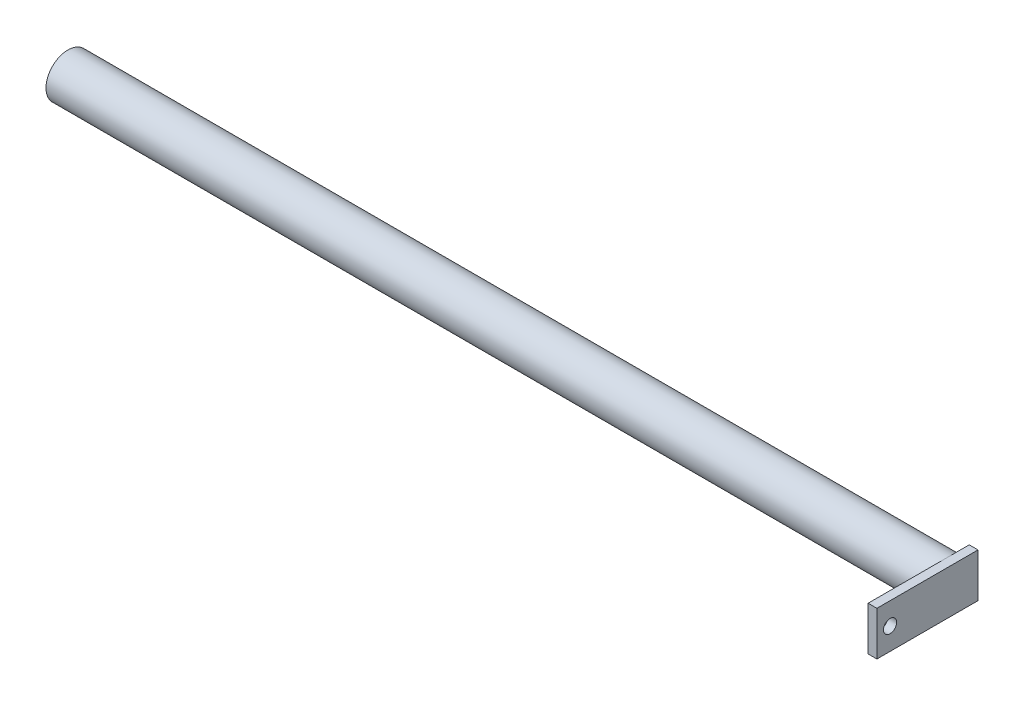
from build123d import *

# Parameters (mm, degrees)
SKETCH2_W           = 400
SKETCH2_H           = 2
SKETCH3_W           = 20
SKETCH3_H           = 46
SKETCH3_R           = 3
BOSS_EXTRUDE1_DEPTH = 4


with BuildPart() as part:
    # Sketch2 → Revolve1 (revolve)
    with BuildSketch(Plane(origin=(0, 0, 0), x_dir=(-1, 0, 0), z_dir=(0, 1, 0))):
        with Locations((0, -9)):
            Rectangle(SKETCH2_W, SKETCH2_H)
    revolve(axis=Axis((0, 0, 0), (1, 0, 0)))

    # Sketch3 → Boss-Extrude1 (add)
    with BuildSketch(Plane.YZ.offset(200)):
        with Locations((0, 13)):
            Rectangle(SKETCH3_W, SKETCH3_H)
        with Locations((0, 30)):
            Circle(SKETCH3_R, mode=Mode.SUBTRACT)
    extrude(amount=BOSS_EXTRUDE1_DEPTH)


solid = part.part
